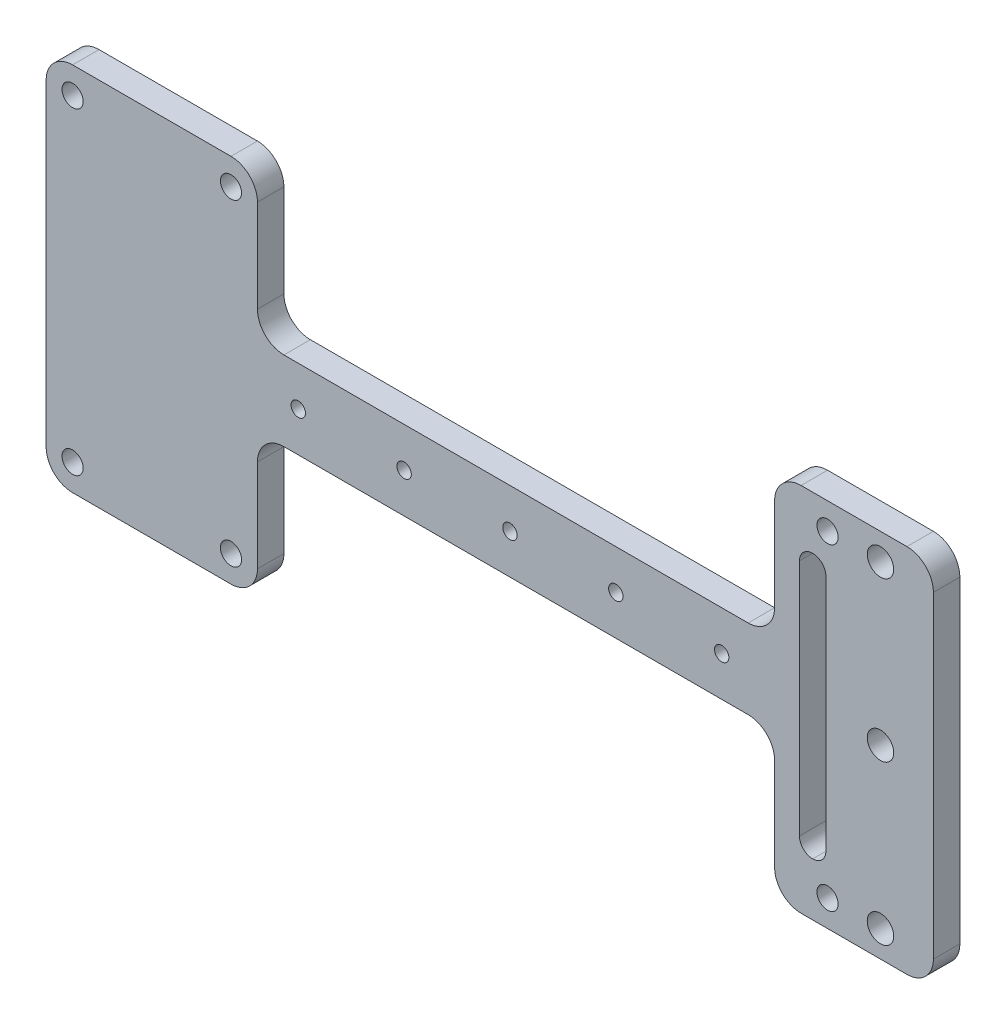
from build123d import *

# Parameters (mm, degrees)
SKETCH4_R           = 2.54
SKETCH4_R_2         = 3.175
SKETCH4_R_3         = 1.7272
SKETCH4_W           = 6.35
SKETCH4_H           = 63.5
BOSS_EXTRUDE4_DEPTH = 6.35
FILLET1_R           = 6.35
FILLET2_R           = 3.175


with BuildPart() as part:
    # Sketch4 → Boss-Extrude4 (new body)
    with BuildSketch(Plane.XY):
        Polygon((58.871875, 44.45), (96.971875, 44.45), (96.971875, -44.45), (58.871875, -44.45), (58.871875, -9.525), (-65.221875, -9.525), (-65.221875, -44.45), (-115.921875, -44.45), (-115.921875, 44.45), (-65.221875, 44.45), (-65.221875, 9.525), (58.871875, 9.525), align=None)
        with Locations((-109.571875, 38.1)):
            Circle(SKETCH4_R, mode=Mode.SUBTRACT)
        with Locations((84.271875, 38.1)):
            Circle(SKETCH4_R_2, mode=Mode.SUBTRACT)
        with Locations((46.171875, 0)):
            Circle(SKETCH4_R_3, mode=Mode.SUBTRACT)
        with Locations((20.771875, 0)):
            Circle(SKETCH4_R_3, mode=Mode.SUBTRACT)
        with Locations((-4.628125, 0)):
            Circle(SKETCH4_R_3, mode=Mode.SUBTRACT)
        with Locations((-30.028125, 0)):
            Circle(SKETCH4_R_3, mode=Mode.SUBTRACT)
        with Locations((71.571875, 38.1)):
            Circle(SKETCH4_R, mode=Mode.SUBTRACT)
        with Locations((-71.571875, 38.1)):
            Circle(SKETCH4_R, mode=Mode.SUBTRACT)
        with Locations(Location((84.271875, -38.1, 0), (0, 0, 180))):
            Circle(SKETCH4_R_2, mode=Mode.SUBTRACT)
        with Locations(Location((71.571875, -38.1, 0), (0, 0, 180))):
            Circle(SKETCH4_R, mode=Mode.SUBTRACT)
        with Locations(Location((-71.571875, -38.1, 0), (0, 0, 180))):
            Circle(SKETCH4_R, mode=Mode.SUBTRACT)
        with Locations(Location((-109.571875, -38.1, 0), (0, 0, 180))):
            Circle(SKETCH4_R, mode=Mode.SUBTRACT)
        with Locations((84.271875, 0)):
            Circle(SKETCH4_R_2, mode=Mode.SUBTRACT)
        with Locations((-55.428125, 0)):
            Circle(SKETCH4_R_3, mode=Mode.SUBTRACT)
        with Locations((68, 0)):
            Rectangle(SKETCH4_W, SKETCH4_H, mode=Mode.SUBTRACT)
    extrude(amount=BOSS_EXTRUDE4_DEPTH)

    # Fillet1
    fillet1_edges = [part.edges().sort_by_distance(p)[0] for p in [
        (58.871875, -9.525, 3.175),
        (-65.221875, -9.525, 3.175),
        (-65.221875, -44.45, 3.175),
        (-115.921875, -44.45, 3.175),
        (-115.921875, 44.45, 3.175),
        (-65.221875, 44.45, 3.175),
        (-65.221875, 9.525, 3.175),
        (58.871875, 9.525, 3.175),
        (58.871875, 44.45, 3.175),
        (96.971875, 44.45, 3.175),
        (96.971875, -44.45, 3.175),
        (58.871875, -44.45, 3.175),
    ]]
    fillet(fillet1_edges, radius=FILLET1_R)

    # Fillet2
    fillet2_edges = [part.edges().sort_by_distance(p)[0] for p in [
        (71.175, 31.75, 3.175),
        (64.825, 31.75, 3.175),
        (71.175, -31.75, 3.175),
        (64.825, -31.75, 3.175),
    ]]
    fillet(fillet2_edges, radius=FILLET2_R - 0.0001)  # a hair under: the kernel refuses the full size


solid = part.part
